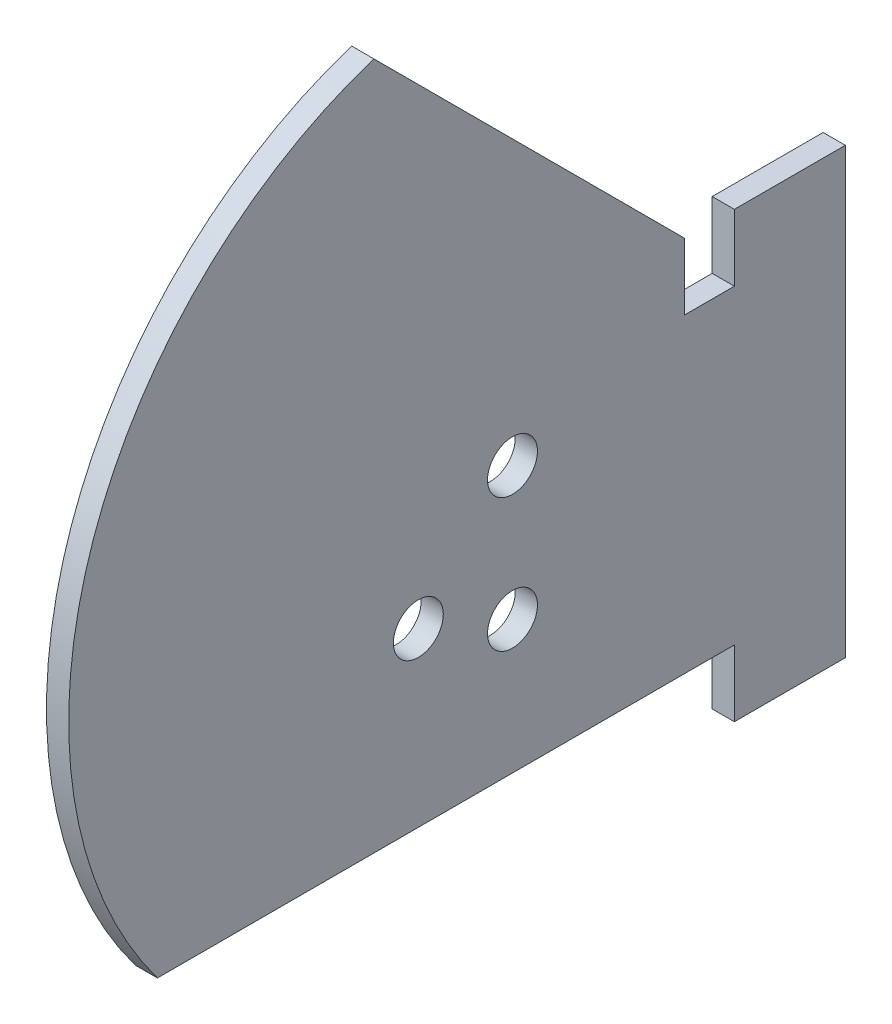
from build123d import *

# Parameters (mm, degrees)
SKETCH1_R           = 1.125
BOSS_EXTRUDE1_DEPTH = 1


with BuildPart() as part:
    # Sketch1 → Boss-Extrude1 (new body)
    with BuildSketch(Plane(origin=(0, 0, 0), x_dir=(0, 0, -1), z_dir=(1, 0, 0))):
        with BuildLine():
            ThreePointArc((-6.248762316, 30.998762316), (-19.078329917, 18.001443791), (-16, 0))
            Line((-16, 0), (10, 0))
            Line((10, 0), (10, -3))
            Line((10, -3), (15, -3))
            Line((15, -3), (15, 17))
            Line((15, 17), (10, 17))
            Line((10, 17), (10, 14))
            Line((10, 14), (7.75, 14))
            Line((7.75, 14), (7.75, 17))
            Line((7.75, 17), (-6.248762316, 30.998762316))
        make_face()
        with Locations((0, 12)):
            Circle(SKETCH1_R, mode=Mode.SUBTRACT)
        with Locations((-4.242640687, 7.757359313)):
            Circle(SKETCH1_R, mode=Mode.SUBTRACT)
        with Locations((0, 6)):
            Circle(SKETCH1_R, mode=Mode.SUBTRACT)
    extrude(amount=BOSS_EXTRUDE1_DEPTH)


solid = part.part
